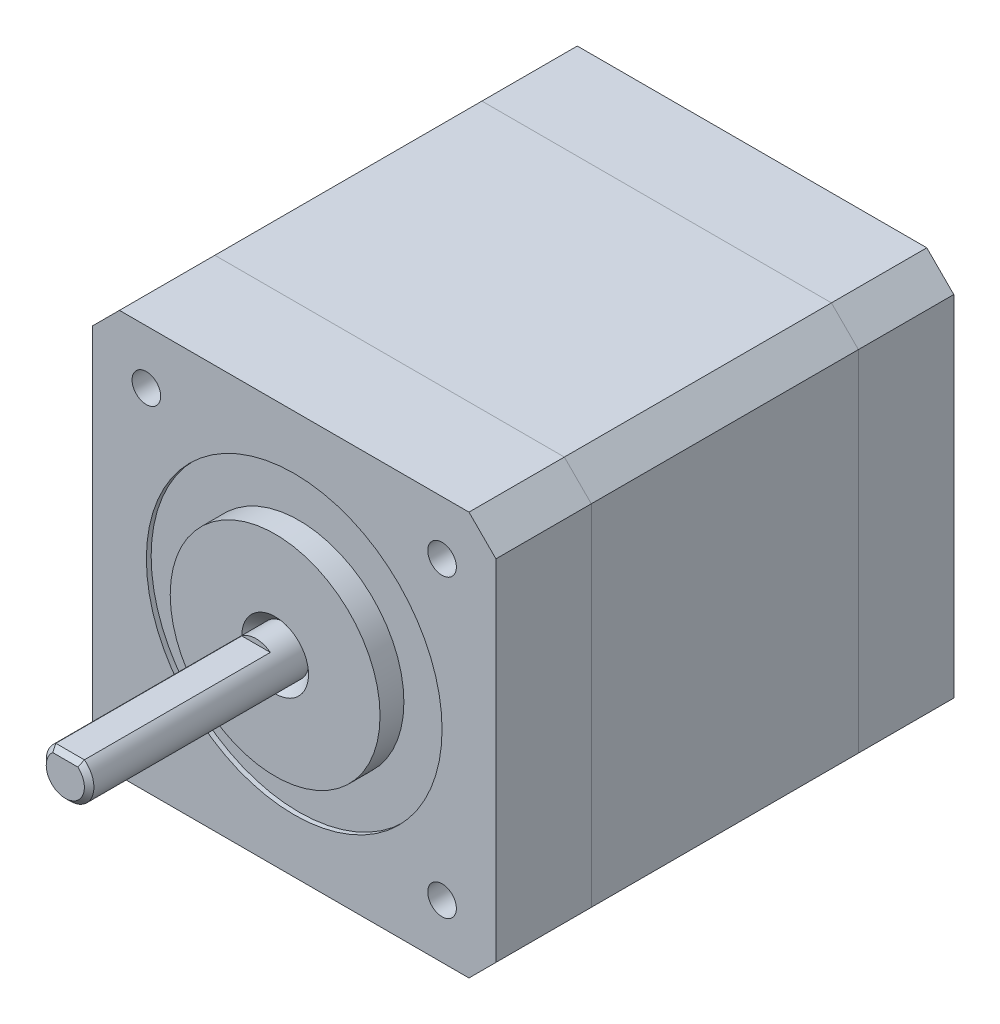
from build123d import *

# Parameters (mm, degrees)
SKETCH_1_R          = 1.5
EXTRUDE_1_DEPTH     = 10
EXTRUDE_2_DEPTH     = 28
EXTRUDE_3_DEPTH     = 10
SKETCH_1_3_R        = 15.5
SKETCH_1_3_R_2      = 11
CUT_EXTRUDE_1_DEPTH = 0.5
EXTRUDE_START       = 2
SKETCH_1_4_R        = 11
SKETCH_1_4_R_2      = 2.5
EXTRUDE_4_DEPTH     = 2
CHAMFER_1_SIZE      = 1
SKETCH_1_5_R        = 2.5
EXTRUDE_5_DEPTH     = 24
CUT_EXTRUDE_2_DEPTH = 20
CHAMFER_2_SIZE      = 0.5


with BuildPart() as part:
    # 草图1 → 凸台-拉伸1 (new body)
    with BuildSketch(Plane.XY):
        Polygon((18.321572875, 21.15), (-18.321572875, 21.15), (-21.15, 18.321572875), (-21.15, -18.321572875), (-18.321572875, -21.15), (18.321572875, -21.15), (21.15, -18.321572875), (21.15, 18.321572875), align=None)
        with Locations((-15.5, 15.5)):
            Circle(SKETCH_1_R, mode=Mode.SUBTRACT)
        with Locations((15.5, 15.5)):
            Circle(SKETCH_1_R, mode=Mode.SUBTRACT)
        with Locations((15.5, -15.5)):
            Circle(SKETCH_1_R, mode=Mode.SUBTRACT)
        with Locations((-15.5, -15.5)):
            Circle(SKETCH_1_R, mode=Mode.SUBTRACT)
    extrude(amount=-EXTRUDE_1_DEPTH)

    # 草图1<3> → 切除-拉伸1 (cut)
    with BuildSketch(Plane.XY):
        Circle(SKETCH_1_3_R)
        Circle(SKETCH_1_3_R_2, mode=Mode.SUBTRACT)
    extrude(amount=-CUT_EXTRUDE_1_DEPTH, mode=Mode.SUBTRACT)

    # 草图1<4> → 凸台-拉伸4 (add)
    with BuildSketch(Plane.XY.offset(EXTRUDE_START)):
        Circle(SKETCH_1_4_R)
        Circle(SKETCH_1_4_R_2, mode=Mode.SUBTRACT)
    extrude(amount=-EXTRUDE_4_DEPTH)

    # 倒角1
    chamfer_1_edges = [part.edges().sort_by_distance(p)[0] for p in [
        (-2.5, 0, 2),
    ]]
    chamfer(chamfer_1_edges, length=CHAMFER_1_SIZE)


with BuildPart() as body_2:
    # 草图2 → 凸台-拉伸2 (new body)
    with BuildSketch(Plane(origin=(0, 0, -10), x_dir=(-1, 0, 0), z_dir=(0, 0, -1))):
        Polygon((-21.15, 18.321572875), (-21.15, -18.321572875), (-18.321572875, -21.15), (18.321572875, -21.15), (21.15, -18.321572875), (21.15, 18.321572875), (18.321572875, 21.15), (-18.321572875, 21.15), align=None)
    extrude(amount=EXTRUDE_2_DEPTH)


with BuildPart() as body_3:
    # 草图3 → 凸台-拉伸3 (new body)
    with BuildSketch(Plane(origin=(0, 0, -38), x_dir=(-1, 0, 0), z_dir=(0, 0, -1))):
        Polygon((-18.321572875, 21.15), (-21.15, 18.321572875), (-21.15, -18.321572875), (-18.321572875, -21.15), (18.321572875, -21.15), (21.15, -18.321572875), (21.15, 18.321572875), (18.321572875, 21.15), align=None)
    extrude(amount=EXTRUDE_3_DEPTH)


with BuildPart() as body_4:
    # 草图1<5> → 凸台-拉伸5 (new body)
    with BuildSketch(Plane.XY):
        Circle(SKETCH_1_5_R)
    extrude(amount=EXTRUDE_5_DEPTH)

    # 草图4 → 切除-拉伸2 (cut)
    with BuildSketch(Plane.XY.offset(24)):
        with BuildLine():
            Line((-1.5, 2), (1.5, 2))
            ThreePointArc((1.5, 2), (0, 2.5), (-1.5, 2))
        make_face()
    extrude(amount=-CUT_EXTRUDE_2_DEPTH, mode=Mode.SUBTRACT)

    # 倒角2
    chamfer_2_edges = [body_4.edges().sort_by_distance(p)[0] for p in [
        (-1.118033989, -2.236067977, 24),
        (0, 2, 24),
    ]]
    chamfer(chamfer_2_edges, length=CHAMFER_2_SIZE - 0.0001)  # a hair under: the kernel refuses the full size


solid = Compound([part.part, body_2.part, body_3.part, body_4.part])
